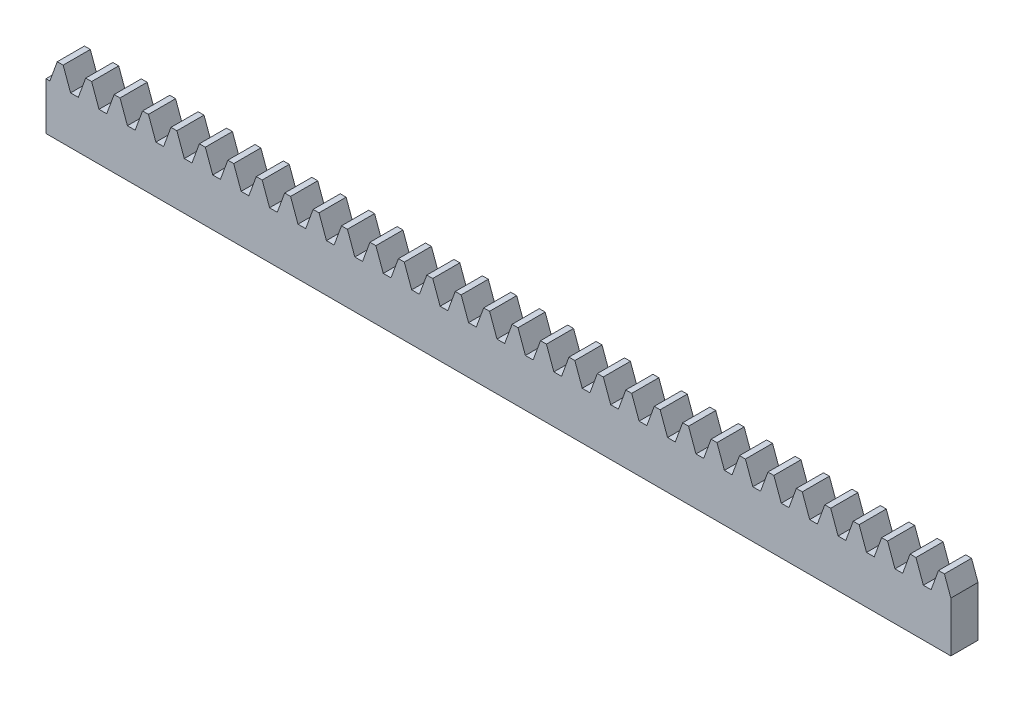
from build123d import *

# Parameters (mm, degrees)
DODANIE_WYCI_GNI_CIE1_DEPTH = 12
WYTNIJ_WYCI_GNI_CIE1_REACH  = 404.592
SZKIC3_W                    = 400
SZKIC3_H                    = 14


with BuildPart() as part:
    # Szkic1 → Dodanie-wyciągnięcie1 (new body)
    with BuildSketch(Plane.XY):
        Polygon((400, 0), (400, 36.15701143), (397.145385613, 44), (394.535962187, 44), (391.260230079, 35), (387.854747121, 35), (384.579015013, 44), (381.969591587, 44), (378.693859479, 35), (375.288376521, 35), (372.012644413, 44), (369.403220987, 44), (366.127488879, 35), (362.722005921, 35), (359.446273813, 44), (356.836850387, 44), (353.561118279, 35), (350.155635321, 35), (346.879903213, 44), (344.270479787, 44), (340.994747679, 35), (337.589264721, 35), (334.313532613, 44), (331.704109187, 44), (328.428377079, 35), (325.022894121, 35), (321.747162013, 44), (319.137738587, 44), (315.862006479, 35), (312.456523521, 35), (309.180791413, 44), (306.571367987, 44), (303.295635879, 35), (299.890152921, 35), (296.614420813, 44), (294.004997387, 44), (290.729265279, 35), (287.323782321, 35), (284.048050213, 44), (281.438626787, 44), (278.162894679, 35), (274.757411721, 35), (271.481679613, 44), (268.872256187, 44), (265.596524079, 35), (262.191041121, 35), (258.915309013, 44), (256.305885587, 44), (253.030153479, 35), (249.624670521, 35), (246.348938413, 44), (243.739514987, 44), (240.463782879, 35), (237.058299921, 35), (233.782567813, 44), (231.173144387, 44), (227.897412279, 35), (224.491929321, 35), (221.216197213, 44), (218.606773787, 44), (215.331041679, 35), (211.925558721, 35), (208.649826613, 44), (206.040403187, 44), (202.764671079, 35), (199.359188121, 35), (196.083456013, 44), (193.474032587, 44), (190.198300479, 35), (186.792817521, 35), (183.517085413, 44), (180.907661987, 44), (177.631929879, 35), (174.226446921, 35), (170.950714813, 44), (168.341291387, 44), (165.065559279, 35), (161.660076321, 35), (158.384344213, 44), (155.774920787, 44), (152.499188679, 35), (149.093705721, 35), (145.817973613, 44), (143.208550187, 44), (139.932818079, 35), (136.527335121, 35), (133.251603013, 44), (130.642179587, 44), (127.366447479, 35), (123.960964521, 35), (120.685232413, 44), (118.075808987, 44), (114.800076879, 35), (111.394593921, 35), (108.118861813, 44), (105.509438387, 44), (102.233706279, 35), (98.828223321, 35), (95.552491213, 44), (92.943067787, 44), (89.667335679, 35), (86.261852721, 35), (82.986120613, 44), (80.376697187, 44), (77.100965079, 35), (73.695482121, 35), (70.419750013, 44), (67.810326587, 44), (64.534594479, 35), (61.129111521, 35), (57.853379413, 44), (55.243955987, 44), (51.968223879, 35), (48.562740921, 35), (45.287008813, 44), (42.677585387, 44), (39.401853279, 35), (35.996370321, 35), (32.720638213, 44), (30.111214787, 44), (26.835482679, 35), (23.429999721, 35), (20.154267613, 44), (17.544844187, 44), (14.269112079, 35), (10.863629121, 35), (7.587897013, 44), (4.978473587, 44), (1.702741479, 35), (0, 35), (0, 0), align=None)
    extrude(amount=DODANIE_WYCI_GNI_CIE1_DEPTH)

    # Szkic3 → Wytnij-wyciągnięcie1 (cut, up to next)
    with BuildSketch(Plane.XY.offset(12), mode=Mode.PRIVATE) as wytnij_wyci_gni_cie1_sk1:
        with Locations((200, 7)):
            Rectangle(SZKIC3_W, SZKIC3_H)
    wytnij_wyci_gni_cie1_tool1 = extrude(wytnij_wyci_gni_cie1_sk1.sketch, amount=-WYTNIJ_WYCI_GNI_CIE1_REACH, mode=Mode.PRIVATE) & part.part
    add(wytnij_wyci_gni_cie1_tool1.solids().sort_by_distance((200, 7, 12))[0], mode=Mode.SUBTRACT)


solid = part.part
